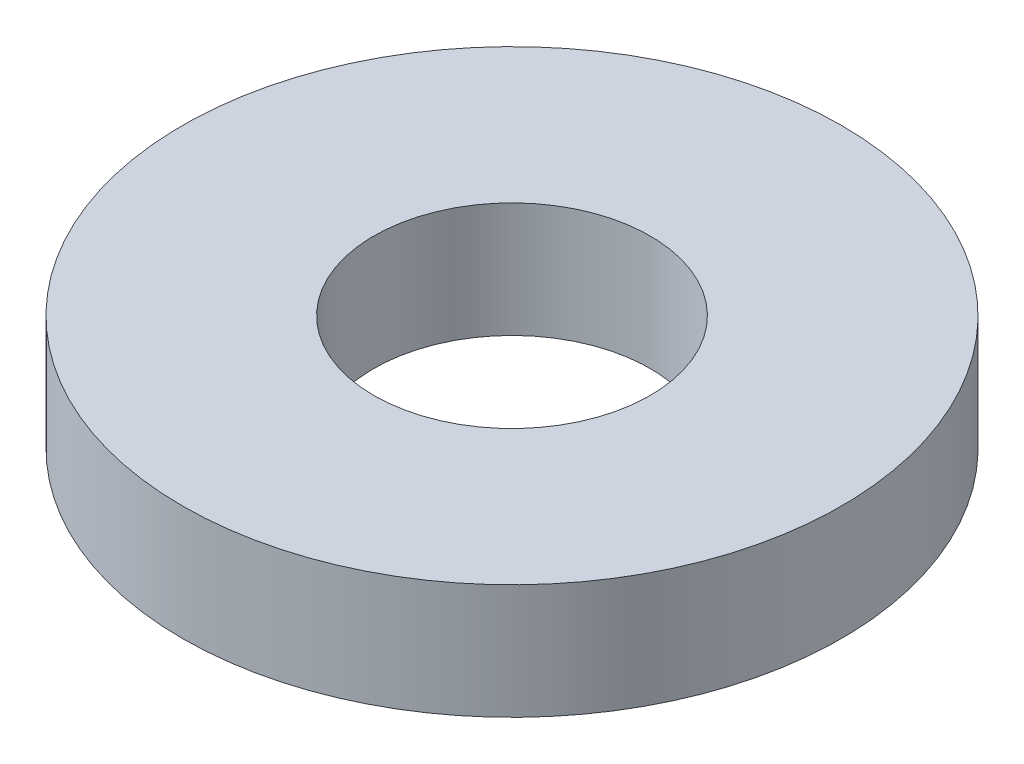
from build123d import *

# Parameters (mm, degrees)
SKETCH1_R           = 77.5
BOSS_EXTRUDE1_DEPTH = 27
SKETCH2_R           = 32.5
CUT_EXTRUDE1_DEPTH  = 113.878252999


with BuildPart() as part:
    # Sketch1 → Boss-Extrude1 (new body)
    with BuildSketch(Plane(origin=(0, 0, 0), x_dir=(1, 0, 0), z_dir=(0, 1, 0))):
        Circle(SKETCH1_R)
    extrude(amount=BOSS_EXTRUDE1_DEPTH)

    # Sketch2 → Cut-Extrude1 (cut, through all)
    with BuildSketch(Plane(origin=(0, 0, 0), x_dir=(1, 0, 0), z_dir=(0, 1, 0))):
        Circle(SKETCH2_R)
    extrude(amount=CUT_EXTRUDE1_DEPTH, mode=Mode.SUBTRACT)


solid = part.part
